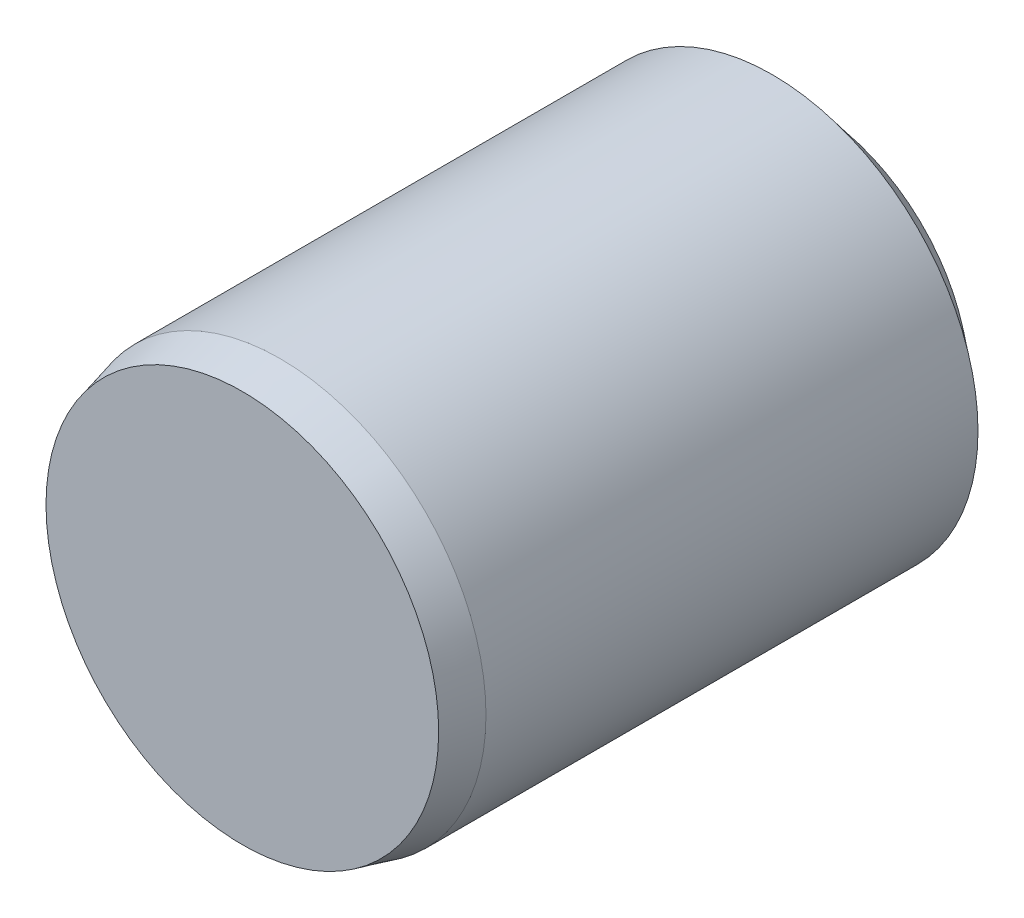
from build123d import *

# Parameters (mm, degrees)
SKETCH4_R = 15.24


with BuildPart() as part:
    # Sketch1 → Revolve1 (revolve)
    with BuildSketch(Plane(origin=(0, 0, 0), x_dir=(0, 0, -1), z_dir=(1, 0, 0))):
        with BuildLine():
            Line((-190.5, 65.88125), (-177.8, 69.05625))
            Line((-177.8, 69.05625), (-12.7, 69.05625))
            Line((-12.7, 69.05625), (0, 53.34))
            Line((0, 53.34), (0, 47.766897345))
            Line((0, 47.766897345), (-12.7, 50.00625))
            Line((-12.7, 50.00625), (-115.09375, 50.00625))
            ThreePointArc((-115.09375, 50.00625), (-150.453508477, 35.359758477), (-165.1, 0))
            Line((-165.1, 0), (-190.5, 0))
            Line((-190.5, 0), (-190.5, 65.88125))
        make_face()
    revolve(axis=Axis((0, 0, 394.569401677), (0, 0, -1)))

    # Sweep1: sweep along a path in Sketch3
    with BuildLine(Plane(origin=(0, 0, 0), x_dir=(0, 0, -1), z_dir=(1, 0, 0))) as sweep1_path:
        Line((-77.588536471, 50.00625), (-59.826150293, -50.00625))
    # Sketch4 → Sweep1 (sweep)
    with BuildSketch(Plane(origin=(0, 0, 0), x_dir=(1, 0, 0), z_dir=(0, 1, 0))):
        with Locations((0, -59.826150293)):
            Circle(SKETCH4_R)
    sweep(path=sweep1_path.line)


solid = part.part
